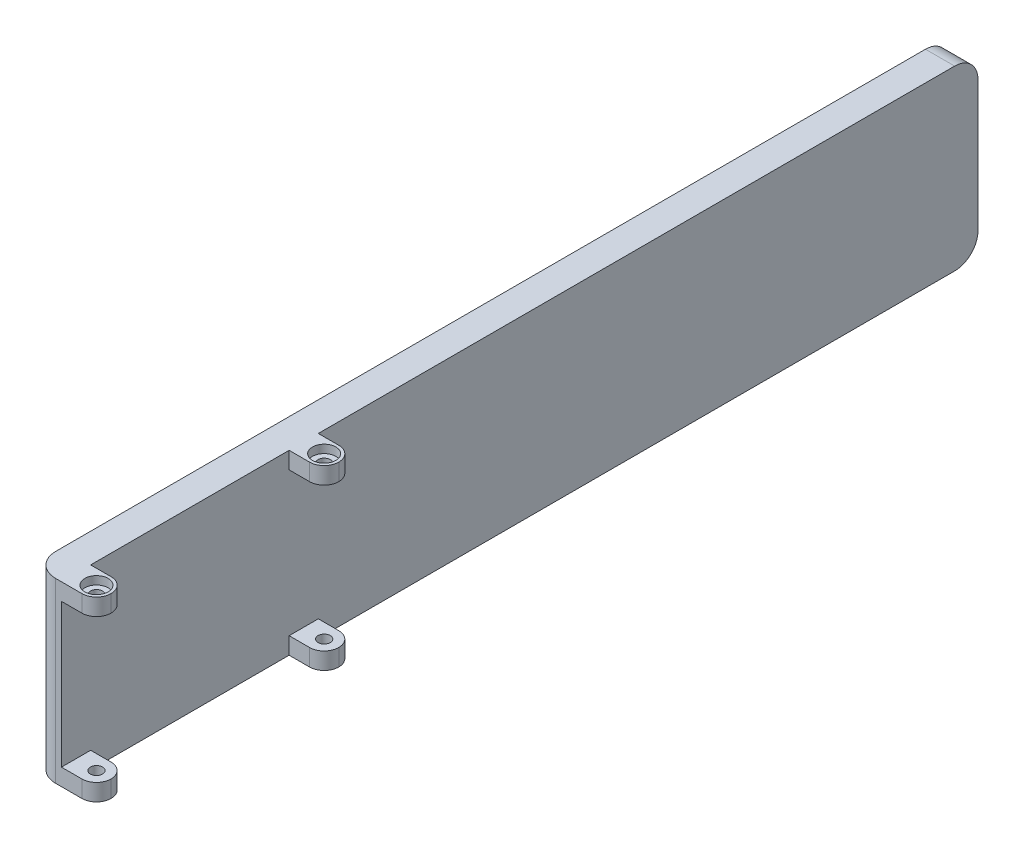
from build123d import *

# Parameters (mm, degrees)
SKETCH1_W           = 5
SKETCH1_H           = 157
BOSS_EXTRUDE1_DEPTH = 30.4
SKETCH2_W           = 5
SKETCH2_H           = 2.9
BOSS_EXTRUDE2_DEPTH = 6
SKETCH3_R           = 1.05
CUT_EXTRUDE1_DEPTH  = 161.02862244
SKETCH4_R           = 2
CUT_EXTRUDE2_DEPTH  = 1.4
FILLET1_R           = 4
FILLET2_R           = 2.5


with BuildPart() as part:
    # Sketch1 → Boss-Extrude1 (new body)
    with BuildSketch(Plane(origin=(0, 0, 0), x_dir=(1, 0, 0), z_dir=(0, 1, 0))):
        with Locations((-2.5, 78.5)):
            Rectangle(SKETCH1_W, SKETCH1_H)
    extrude(amount=BOSS_EXTRUDE1_DEPTH)

    # Sketch2 → Boss-Extrude2 (add)
    with BuildSketch(Plane(origin=(0, 0, 0), x_dir=(0, 0, -1), z_dir=(1, 0, 0))):
        with Locations((2.5, 28.95)):
            Rectangle(SKETCH2_W, SKETCH2_H)
        with Locations((41.5, 28.95)):
            Rectangle(SKETCH2_W, SKETCH2_H)
        with Locations((41.5, 1.45)):
            Rectangle(SKETCH2_W, SKETCH2_H)
        with Locations((2.5, 1.45)):
            Rectangle(SKETCH2_W, SKETCH2_H)
    extrude(amount=BOSS_EXTRUDE2_DEPTH)

    # Sketch3 → Cut-Extrude1 (cut, through all)
    with BuildSketch(Plane(origin=(0, 30.4, 0), x_dir=(1, 0, 0), z_dir=(0, 1, 0))):
        with Locations(Location((3.5, 41.5, 0), (0, 0, 270))):
            Circle(SKETCH3_R)
        with Locations(Location((3.5, 2.5, 0), (0, 0, 270))):
            Circle(SKETCH3_R)
    extrude(amount=-CUT_EXTRUDE1_DEPTH, mode=Mode.SUBTRACT)

    # Sketch4 → Cut-Extrude2 (cut)
    with BuildSketch(Plane(origin=(0, 30.4, 0), x_dir=(1, 0, 0), z_dir=(0, 1, 0))):
        with Locations(Location((3.5, 41.5, 0), (0, 0, 270))):
            Circle(SKETCH4_R)
        with Locations(Location((3.5, 2.5, 0), (0, 0, 270))):
            Circle(SKETCH4_R)
    cut_extrude2 = extrude(amount=-CUT_EXTRUDE2_DEPTH, mode=Mode.SUBTRACT)

    # Mirror2: Cut-Extrude2 across plane
    add(cut_extrude2.mirror(Plane.ZX.offset(15.2)), mode=Mode.SUBTRACT)

    # Fillet1
    fillet1_edges = [part.edges().sort_by_distance(p)[0] for p in [
        (-2.5, 0, -157),
        (-5, 15.2, 0),
        (-2.5, 30.4, -157),
    ]]
    fillet(fillet1_edges, radius=FILLET1_R)

    # Fillet2
    fillet2_edges = [part.edges().sort_by_distance(p)[0] for p in [
        (6, 1.45, -5),
        (6, 1.45, 0),
        (6, 1.45, -44),
        (6, 1.45, -39),
        (6, 28.95, -44),
        (6, 28.95, -39),
        (6, 28.95, -5),
        (6, 28.95, 0),
    ]]
    fillet(fillet2_edges, radius=FILLET2_R - 0.0001)  # a hair under: the kernel refuses the full size


solid = part.part
